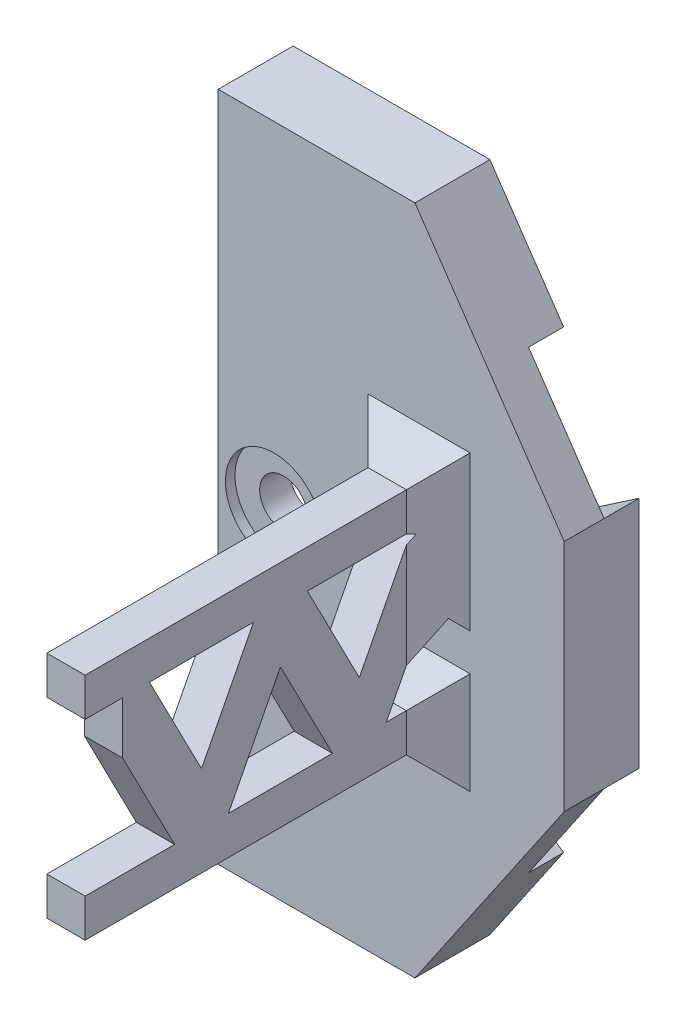
from build123d import *

# Parameters (mm, degrees)
BOSS_EXTRUDE1_DEPTH   = 2.2
BOSS_EXTRUDE1_2_DEPTH = 2.2
BOSS_EXTRUDE1_3_DEPTH = 2.2
SKETCH3_R             = 1.5
BOSS_EXTRUDE2_DEPTH   = 2.5
SKETCH4_R             = 3.05
CUT_EXTRUDE1_DEPTH    = 0.6
SKETCH5_W             = 2.4
SKETCH5_H             = 2.4
BOSS_EXTRUDE3_DEPTH   = 22.15
BOSS_EXTRUDE4_DEPTH   = 2.4
CHAMFER1_SIZE         = 2
CHAMFER1_SIZE_2       = 1.48467926


with BuildPart() as part:
    # Sketch1 → Boss-Extrude1 (new body)
    with BuildSketch(Plane.XY):
        Polygon((-3.5, 21.055685406), (-3.5, 10.2), (5.888972746, 10.2), (6.342667922, 9.414176903), (13.466375906, 14.276390289), (8.839237969, 21.055685406), align=None)
    extrude(amount=BOSS_EXTRUDE1_DEPTH)



with BuildPart() as body_2:
    # Sketch1 → Boss-Extrude1 2 (new body)
    with BuildSketch(Plane.XY):
        Polygon((18.201821848, -7.338411352), (10.554607275, -2.118883945), (11.777945491, 0), (10.554607275, 2.118883945), (18.201821848, 7.338411352), align=None)
    extrude(amount=BOSS_EXTRUDE1_2_DEPTH)


with BuildPart() as body_3:
    # Sketch1 → Boss-Extrude1 3 (new body)
    with BuildSketch(Plane.XY):
        Polygon((8.839237969, -21.055685406), (13.466375906, -14.276390289), (6.342667922, -9.414176903), (5.888972746, -10.2), (-3.5, -10.2), (-3.5, -21.055685406), align=None)
    extrude(amount=BOSS_EXTRUDE1_3_DEPTH)


with BuildPart() as part_1:
    add(part.part)

    add(body_2.part)  # Boss-Extrude2 merges body 2

    add(body_3.part)  # Boss-Extrude2 merges body 3
    # Sketch3 → Boss-Extrude2 (add)
    with BuildSketch(Plane.XY.offset(2.2)):
        Polygon((-3.5, 21.055685406), (-3.5, -21.055685406), (8.839237969, -21.055685406), (18.201821848, -7.338411352), (18.201821848, 7.338411352), (8.839237969, 21.055685406), align=None)
        Circle(SKETCH3_R, mode=Mode.SUBTRACT)
    extrude(amount=BOSS_EXTRUDE2_DEPTH)

    # Sketch4 → Cut-Extrude1 (cut)
    with BuildSketch(Plane.XY.offset(4.7)):
        Circle(SKETCH4_R)
    extrude(amount=-CUT_EXTRUDE1_DEPTH, mode=Mode.SUBTRACT)

    # Sketch5 → Boss-Extrude3 (add)
    with BuildSketch(Plane.XY.offset(4.7)):
        with Locations((9.100910924, 6)):
            Rectangle(SKETCH5_W, SKETCH5_H)
        with Locations((9.100910924, -6)):
            Rectangle(SKETCH5_W, SKETCH5_H)
    extrude(amount=BOSS_EXTRUDE3_DEPTH)

    # Sketch6 → Boss-Extrude4 (add)
    with BuildSketch(Plane(origin=(10.300910924, 0, 0), x_dir=(0, 0, -1), z_dir=(1, 0, 0))):
        Polygon((-6.387662753, 4.8), (-9.65, -1.526957086), (-12.912337247, 4.8), (-16.287662753, 4.8), (-19.55, -1.526957086), (-22.812337247, 4.8), (-24.5, 4.8), (-24.5, 1.526957086), (-21.237662753, -4.8), (-17.862337247, -4.8), (-14.6, 1.526957086), (-11.337662753, -4.8), (-7.962337247, -4.8), (-4.7, 1.526957086), (-4.7, 4.8), align=None)
    extrude(amount=-BOSS_EXTRUDE4_DEPTH)

    # Chamfer1
    # the kernel refuses this chamfer: 2, 1.48467926 mm, written as the material it adds along each edge
    with BuildSketch(Plane(origin=(15.4442769, 1.526957086, 4.7), x_dir=(0, -1, 0), z_dir=(-1, 0, 0))) as chamfer1_piece_1_section:
        Polygon((CHAMFER1_SIZE, 0), (CHAMFER1_SIZE_2 * 0.888803167403, CHAMFER1_SIZE_2 * 0.458289133192), (0, 0), align=None)
    chamfer1_piece_1 = extrude(amount=12.686731952, mode=Mode.PRIVATE)
    chamfer1_piece_1 = split(chamfer1_piece_1, bisect_by=Plane(origin=(10.672593912, 1.526957086, 9.471682988), z_dir=(0.7071067811865476, 0, -0.7071067811865476)), keep=Keep.TOP, mode=Mode.PRIVATE)
    chamfer1_piece_1 = split(chamfer1_piece_1, bisect_by=Plane(origin=(13.872593912, 1.526957086, 3.128317012), z_dir=(-0.7071067811865476, 0, -0.7071067811865476)), keep=Keep.TOP, mode=Mode.PRIVATE)
    add(chamfer1_piece_1)
    with BuildSketch(Plane(origin=(2.757544948, 7.2, 4.7), x_dir=(0, 1, 0), z_dir=(1, 0, 0))) as chamfer1_piece_2_section:
        Polygon((CHAMFER1_SIZE, 0), (0, CHAMFER1_SIZE), (0, 0), align=None)
    chamfer1_piece_2 = extrude(amount=12.686731952, mode=Mode.PRIVATE)
    chamfer1_piece_2 = split(chamfer1_piece_2, bisect_by=Plane(origin=(4.329227936, 7.2, 3.128317012), z_dir=(0.7071067811865476, 0, -0.7071067811865476)), keep=Keep.TOP, mode=Mode.PRIVATE)
    chamfer1_piece_2 = split(chamfer1_piece_2, bisect_by=Plane(origin=(7.529227936, 7.2, 9.471682988), z_dir=(-0.7071067811865476, 0, -0.7071067811865476)), keep=Keep.TOP, mode=Mode.PRIVATE)
    add(chamfer1_piece_2)
    with BuildSketch(Plane(origin=(10.300910924, 12.343365976, 4.7), x_dir=(1, 0, 0), z_dir=(0, -1, 0))) as chamfer1_piece_3_section:
        Polygon((CHAMFER1_SIZE, 0), (0, CHAMFER1_SIZE), (0, 0), align=None)
    chamfer1_piece_3 = extrude(amount=15.959774866, mode=Mode.PRIVATE)
    chamfer1_piece_3 = split(chamfer1_piece_3, bisect_by=Plane(origin=(10.300910924, 4.8, 4.7), z_dir=(0, 1, 0)), keep=Keep.TOP, mode=Mode.PRIVATE)
    chamfer1_piece_3 = split(chamfer1_piece_3, bisect_by=Plane(origin=(10.300910924, 10.771682988, 3.128317012), z_dir=(0, -0.7071067811865476, -0.7071067811865476)), keep=Keep.TOP, mode=Mode.PRIVATE)
    add(chamfer1_piece_3)
    with BuildSketch(Plane(origin=(10.300910924, 12.343365976, 4.7), x_dir=(1, 0, 0), z_dir=(0, -1, 0))) as chamfer1_piece_4_section:
        Polygon((CHAMFER1_SIZE, 0), (0, CHAMFER1_SIZE), (0, 0), align=None)
    chamfer1_piece_4 = extrude(amount=15.959774866, mode=Mode.PRIVATE)
    chamfer1_piece_4 = split(chamfer1_piece_4, bisect_by=Plane(origin=(10.300910924, 11.446474594, 2.96057429), z_dir=(0, -0.4582891331950048, -0.8888031674084939)), keep=Keep.TOP, mode=Mode.PRIVATE)
    chamfer1_piece_4 = split(chamfer1_piece_4, bisect_by=Plane(origin=(10.300910924, 5.935161531, 11.108204445), z_dir=(0, 0.7071067811865488, -0.7071067811865462)), keep=Keep.TOP, mode=Mode.PRIVATE)
    add(chamfer1_piece_4)
    with BuildSketch(Plane(origin=(10.300910924, 12.343365976, 4.7), x_dir=(1, 0, 0), z_dir=(0, -1, 0))) as chamfer1_piece_5_section:
        Polygon((CHAMFER1_SIZE, 0), (0, CHAMFER1_SIZE), (0, 0), align=None)
    chamfer1_piece_5 = extrude(amount=15.959774866, mode=Mode.PRIVATE)
    chamfer1_piece_5 = split(chamfer1_piece_5, bisect_by=Plane(origin=(10.300910924, 10.071607195, 0.294164788), z_dir=(0, 0.4582891331950048, 0.8888031674084939)), keep=Keep.TOP, mode=Mode.PRIVATE)
    chamfer1_piece_5 = split(chamfer1_piece_5, bisect_by=Plane(origin=(10.300910924, 5.935161531, 11.108204445), z_dir=(0, -0.7071067811865488, 0.7071067811865462)), keep=Keep.TOP, mode=Mode.PRIVATE)
    add(chamfer1_piece_5)
    with BuildSketch(Plane(origin=(7.900910924, -3.61640889, 4.7), x_dir=(-1, 0, 0), z_dir=(0, 1, 0))) as chamfer1_piece_6_section:
        Polygon((CHAMFER1_SIZE, 0), (0, CHAMFER1_SIZE), (0, 0), align=None)
    chamfer1_piece_6 = extrude(amount=15.959774866, mode=Mode.PRIVATE)
    chamfer1_piece_6 = split(chamfer1_piece_6, bisect_by=Plane(origin=(7.900910924, -2.53615324, 6.795041262), z_dir=(0, 0.4582891331950048, 0.8888031674084939)), keep=Keep.TOP, mode=Mode.PRIVATE)
    chamfer1_piece_6 = split(chamfer1_piece_6, bisect_by=Plane(origin=(7.900910924, -1.16128584, 9.461450764), z_dir=(0, -0.4582891331950048, -0.8888031674084939)), keep=Keep.TOP, mode=Mode.PRIVATE)
    add(chamfer1_piece_6)
    with BuildSketch(Plane(origin=(7.900910924, -3.61640889, 4.7), x_dir=(-1, 0, 0), z_dir=(0, 1, 0))) as chamfer1_piece_7_section:
        Polygon((CHAMFER1_SIZE, 0), (0, CHAMFER1_SIZE), (0, 0), align=None)
    chamfer1_piece_7 = extrude(amount=15.959774866, mode=Mode.PRIVATE)
    chamfer1_piece_7 = split(chamfer1_piece_7, bisect_by=Plane(origin=(7.900910924, -1.16128584, 9.461450764), z_dir=(0, -0.4582891331950048, -0.8888031674084939)), keep=Keep.TOP, mode=Mode.PRIVATE)
    chamfer1_piece_7 = split(chamfer1_piece_7, bisect_by=Plane(origin=(7.900910924, -2.044725902, 3.128317012), z_dir=(0, 0.7071067811865488, -0.7071067811865462)), keep=Keep.TOP, mode=Mode.PRIVATE)
    add(chamfer1_piece_7)
    with BuildSketch(Plane(origin=(7.900910924, -3.61640889, 4.7), x_dir=(-1, 0, 0), z_dir=(0, 1, 0))) as chamfer1_piece_8_section:
        Polygon((CHAMFER1_SIZE, 0), (0, CHAMFER1_SIZE), (0, 0), align=None)
    chamfer1_piece_8 = extrude(amount=15.959774866, mode=Mode.PRIVATE)
    chamfer1_piece_8 = split(chamfer1_piece_8, bisect_by=Plane(origin=(7.900910924, 4.8, 4.7), z_dir=(0, 1, 0)), keep=Keep.TOP, mode=Mode.PRIVATE)
    chamfer1_piece_8 = split(chamfer1_piece_8, bisect_by=Plane(origin=(7.900910924, 2.791795555, 11.108204445), z_dir=(0, -0.7071067811865476, -0.7071067811865476)), keep=Keep.TOP, mode=Mode.PRIVATE)
    add(chamfer1_piece_8)
    with BuildSketch(Plane(origin=(2.757544948, -4.8, 4.7), x_dir=(0, 1, 0), z_dir=(1, 0, 0))) as chamfer1_piece_9_section:
        Polygon((CHAMFER1_SIZE, 0), (0, CHAMFER1_SIZE), (0, 0), align=None)
    chamfer1_piece_9 = extrude(amount=12.686731952, mode=Mode.PRIVATE)
    chamfer1_piece_9 = split(chamfer1_piece_9, bisect_by=Plane(origin=(4.329227936, -4.8, 3.128317012), z_dir=(0.7071067811865476, 0, -0.7071067811865476)), keep=Keep.TOP, mode=Mode.PRIVATE)
    chamfer1_piece_9 = split(chamfer1_piece_9, bisect_by=Plane(origin=(7.529227936, -4.8, 9.471682988), z_dir=(-0.7071067811865476, 0, -0.7071067811865476)), keep=Keep.TOP, mode=Mode.PRIVATE)
    add(chamfer1_piece_9)
    with BuildSketch(Plane(origin=(10.300910924, 0.343365976, 4.7), x_dir=(1, 0, 0), z_dir=(0, -1, 0))) as chamfer1_piece_10_section:
        Polygon((CHAMFER1_SIZE, 0), (0, CHAMFER1_SIZE), (0, 0), align=None)
    chamfer1_piece_10 = extrude(amount=12.686731952, mode=Mode.PRIVATE)
    chamfer1_piece_10 = split(chamfer1_piece_10, bisect_by=Plane(origin=(10.300910924, 0.59195435, 5.182110786), z_dir=(0, 0.4582891331950048, 0.8888031674084939)), keep=Keep.TOP, mode=Mode.PRIVATE)
    add(chamfer1_piece_10)
    with BuildSketch(Plane(origin=(10.300910924, 0.343365976, 4.7), x_dir=(1, 0, 0), z_dir=(0, -1, 0))) as chamfer1_piece_11_section:
        Polygon((CHAMFER1_SIZE, 0), (0, CHAMFER1_SIZE), (0, 0), align=None)
    chamfer1_piece_11 = extrude(amount=12.686731952, mode=Mode.PRIVATE)
    chamfer1_piece_11 = split(chamfer1_piece_11, bisect_by=Plane(origin=(10.300910924, -4.428317012, 9.471682988), z_dir=(0, 0.7071067811865477, -0.7071067811865474)), keep=Keep.TOP, mode=Mode.PRIVATE)
    chamfer1_piece_11 = split(chamfer1_piece_11, bisect_by=Plane(origin=(10.300910924, -1.228317012, 3.128317012), z_dir=(0, -0.7071067811865476, -0.7071067811865476)), keep=Keep.TOP, mode=Mode.PRIVATE)
    add(chamfer1_piece_11)
    with BuildSketch(Plane(origin=(15.4442769, -7.2, 4.7), x_dir=(0, -1, 0), z_dir=(-1, 0, 0))) as chamfer1_piece_12_section:
        Polygon((CHAMFER1_SIZE, 0), (0, CHAMFER1_SIZE), (0, 0), align=None)
    chamfer1_piece_12 = extrude(amount=12.686731952, mode=Mode.PRIVATE)
    chamfer1_piece_12 = split(chamfer1_piece_12, bisect_by=Plane(origin=(10.672593912, -7.2, 9.471682988), z_dir=(0.7071067811865476, 0, -0.7071067811865476)), keep=Keep.TOP, mode=Mode.PRIVATE)
    chamfer1_piece_12 = split(chamfer1_piece_12, bisect_by=Plane(origin=(13.872593912, -7.2, 3.128317012), z_dir=(-0.7071067811865476, 0, -0.7071067811865476)), keep=Keep.TOP, mode=Mode.PRIVATE)
    add(chamfer1_piece_12)
    with BuildSketch(Plane(origin=(7.900910924, -12.343365976, 4.7), x_dir=(-1, 0, 0), z_dir=(0, 1, 0))) as chamfer1_piece_13_section:
        Polygon((CHAMFER1_SIZE, 0), (0, CHAMFER1_SIZE), (0, 0), align=None)
    chamfer1_piece_13 = extrude(amount=12.686731952, mode=Mode.PRIVATE)
    chamfer1_piece_13 = split(chamfer1_piece_13, bisect_by=Plane(origin=(7.900910924, -10.771682988, 3.128317012), z_dir=(0, 0.7071067811865477, -0.7071067811865474)), keep=Keep.TOP, mode=Mode.PRIVATE)
    chamfer1_piece_13 = split(chamfer1_piece_13, bisect_by=Plane(origin=(7.900910924, -7.571682988, 9.471682988), z_dir=(0, -0.7071067811865476, -0.7071067811865476)), keep=Keep.TOP, mode=Mode.PRIVATE)
    add(chamfer1_piece_13)
    with BuildSketch(Plane(origin=(7.900910924, -12.343365976, 4.7), x_dir=(-1, 0, 0), z_dir=(0, 1, 0))) as chamfer1_piece_14_section:
        Polygon((CHAMFER1_SIZE, 0), (0, CHAMFER1_SIZE), (0, 0), align=None)
    chamfer1_piece_14 = extrude(amount=12.686731952, mode=Mode.PRIVATE)
    chamfer1_piece_14 = split(chamfer1_piece_14, bisect_by=Plane(origin=(7.900910924, -9.43019687, 10.349782509), z_dir=(0, 0.4582891331950048, 0.8888031674084939)), keep=Keep.TOP, mode=Mode.PRIVATE)
    add(chamfer1_piece_14)


solid = part_1.part
